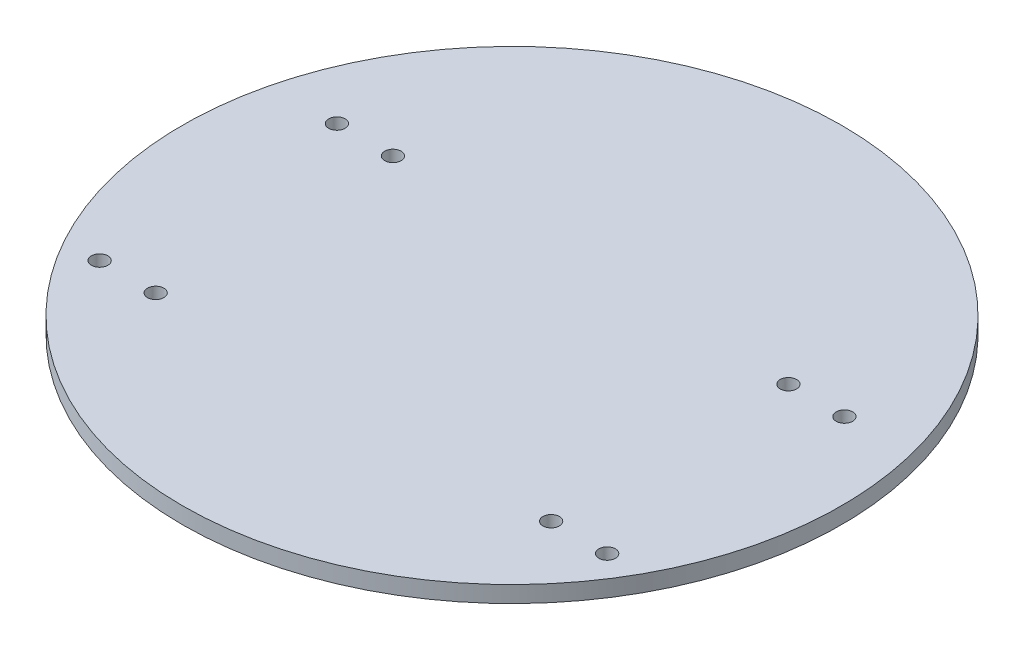
from build123d import *

# Parameters (mm, degrees)
SKETCH1_R           = 100
BOSS_EXTRUDE1_DEPTH = 5
SKETCH2_R           = 2.5
CUT_EXTRUDE1_DEPTH  = 10


with BuildPart() as part:
    # Sketch1 → Boss-Extrude1 (new body)
    with BuildSketch(Plane(origin=(0, 0, 0), x_dir=(1, 0, 0), z_dir=(0, 1, 0))):
        Circle(SKETCH1_R)
    extrude(amount=BOSS_EXTRUDE1_DEPTH)

    # Sketch2 → Cut-Extrude1 (cut)
    with BuildSketch(Plane(origin=(0, 5, 0), x_dir=(1, 0, 0), z_dir=(0, 1, 0))):
        with Locations((-77, -48.128296411)):
            Circle(SKETCH2_R)
        with Locations((-77, 23.871703589)):
            Circle(SKETCH2_R)
        with Locations((-60, -48.128296411)):
            Circle(SKETCH2_R)
        with Locations((-60, 23.871703589)):
            Circle(SKETCH2_R)
        with Locations((60, 23.871703589)):
            Circle(SKETCH2_R)
        with Locations((60, -48.128296411)):
            Circle(SKETCH2_R)
        with Locations((77, 23.871703589)):
            Circle(SKETCH2_R)
        with Locations((77, -48.128296411)):
            Circle(SKETCH2_R)
    extrude(amount=-CUT_EXTRUDE1_DEPTH, mode=Mode.SUBTRACT)


solid = part.part
